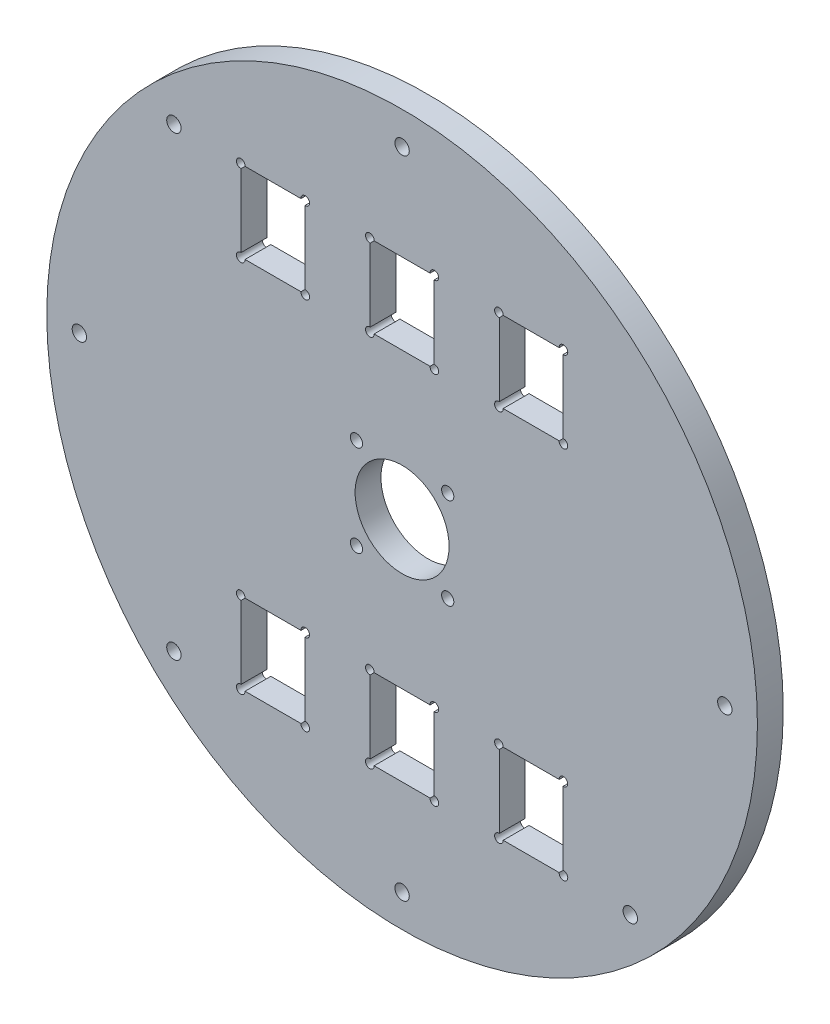
from build123d import *

# Parameters (mm, degrees)
SKETCH1_R              = 82.5
SKETCH1_R_2            = 11
SKETCH1_R_3            = 1.5
SKETCH1_R_4            = 1.75
BOSS_EXTRUDE1_DEPTH    = 6
SKETCH5_W              = 15
SKETCH5_H              = 18.9
CUT_EXTRUDE4_DEPTH     = 117.826794872
SKETCH6_R              = 1
CUT_EXTRUDE5_DEPTH     = 117.826794872
MOVE_FACE1_OUTLINE_R   = 82.58
MOVE_FACE1_OUTLINE_R_2 = 82.5
MOVE_FACE1_OUTLINE_R_3 = 11
MOVE_FACE1_OUTLINE_R_4 = 10.92
MOVE_FACE1_OUTLINE_R_5 = 1.5
MOVE_FACE1_OUTLINE_R_6 = 1.42
MOVE_FACE1_OUTLINE_R_7 = 1.75
MOVE_FACE1_OUTLINE_R_8 = 1.67
MOVE_FACE1_DEPTH       = 6


# Read off the part's stored shape, not the designer's step: Move Face1
with BuildPart() as part:
    # Sketch1 → Boss-Extrude1 (new body)
    with BuildSketch(Plane.XY):
        Circle(SKETCH1_R)
        Circle(SKETCH1_R_2, mode=Mode.SUBTRACT)
        with Locations((10.606601718, -10.606601718)):
            Circle(SKETCH1_R_3, mode=Mode.SUBTRACT)
        with Locations((0, -75)):
            Circle(SKETCH1_R_4, mode=Mode.SUBTRACT)
        with Locations((-10.606601718, -10.606601718)):
            Circle(SKETCH1_R_3, mode=Mode.SUBTRACT)
        with Locations((-10.606601718, 10.606601718)):
            Circle(SKETCH1_R_3, mode=Mode.SUBTRACT)
        with Locations((10.606601718, 10.606601718)):
            Circle(SKETCH1_R_3, mode=Mode.SUBTRACT)
        with Locations((-53.033008589, -53.033008589)):
            Circle(SKETCH1_R_4, mode=Mode.SUBTRACT)
        with Locations((-75, 0)):
            Circle(SKETCH1_R_4, mode=Mode.SUBTRACT)
        with Locations((-53.033008589, 53.033008589)):
            Circle(SKETCH1_R_4, mode=Mode.SUBTRACT)
        with Locations((0, 75)):
            Circle(SKETCH1_R_4, mode=Mode.SUBTRACT)
        with Locations((75, 0)):
            Circle(SKETCH1_R_4, mode=Mode.SUBTRACT)
        with Locations((53.033008589, -53.033008589)):
            Circle(SKETCH1_R_4, mode=Mode.SUBTRACT)
    extrude(amount=BOSS_EXTRUDE1_DEPTH)

    # Sketch5 → Cut-Extrude4 (cut, through all)
    with BuildSketch(Plane.XY.offset(6)):
        with Locations((-30, -43.45)):
            Rectangle(SKETCH5_W, SKETCH5_H)
        with Locations((-30, 43.45)):
            Rectangle(SKETCH5_W, SKETCH5_H)
        with Locations((30, 43.45)):
            Rectangle(SKETCH5_W, SKETCH5_H)
        with Locations((0, -43.45)):
            Rectangle(SKETCH5_W, SKETCH5_H)
        with Locations((30, -43.45)):
            Rectangle(SKETCH5_W, SKETCH5_H)
        with Locations((0, 43.45)):
            Rectangle(SKETCH5_W, SKETCH5_H)
    extrude(amount=-CUT_EXTRUDE4_DEPTH, mode=Mode.SUBTRACT)

    # Sketch6 → Cut-Extrude5 (cut, through all)
    with BuildSketch(Plane.XY.offset(6)):
        with Locations((-37.5, 52.9)):
            Circle(SKETCH6_R)
        with Locations((-22.5, 52.9)):
            Circle(SKETCH6_R)
        with Locations((-37.5, 34)):
            Circle(SKETCH6_R)
        with Locations((-22.5, 34)):
            Circle(SKETCH6_R)
        with Locations((-7.5, 52.9)):
            Circle(SKETCH6_R)
        with Locations((7.5, 52.9)):
            Circle(SKETCH6_R)
        with Locations((-7.5, 34)):
            Circle(SKETCH6_R)
        with Locations((7.5, 34)):
            Circle(SKETCH6_R)
        with Locations((22.5, 52.9)):
            Circle(SKETCH6_R)
        with Locations((37.5, 52.9)):
            Circle(SKETCH6_R)
        with Locations((22.5, 34)):
            Circle(SKETCH6_R)
        with Locations((37.5, 34)):
            Circle(SKETCH6_R)
        with Locations((-37.5, -34)):
            Circle(SKETCH6_R)
        with Locations((-22.5, -34)):
            Circle(SKETCH6_R)
        with Locations((-37.5, -52.9)):
            Circle(SKETCH6_R)
        with Locations((-22.5, -52.9)):
            Circle(SKETCH6_R)
        with Locations((-7.5, -34)):
            Circle(SKETCH6_R)
        with Locations((7.5, -34)):
            Circle(SKETCH6_R)
        with Locations((-7.5, -52.9)):
            Circle(SKETCH6_R)
        with Locations((7.5, -52.9)):
            Circle(SKETCH6_R)
        with Locations((22.5, -34)):
            Circle(SKETCH6_R)
        with Locations((37.5, -34)):
            Circle(SKETCH6_R)
        with Locations((22.5, -52.9)):
            Circle(SKETCH6_R)
        with Locations((37.5, -52.9)):
            Circle(SKETCH6_R)
    extrude(amount=-CUT_EXTRUDE5_DEPTH, mode=Mode.SUBTRACT)

    # Move Face1 outline → Move Face1 (add)
    # profile 1 of 37: a face of its own
    with BuildSketch(Plane.XY):
        Circle(MOVE_FACE1_OUTLINE_R)
        Circle(MOVE_FACE1_OUTLINE_R_2, mode=Mode.SUBTRACT)
    # profile 2 of 37: a face of its own
    with BuildSketch(Plane.XY):
        with BuildLine():
            Line((-37.42, -51.903205136), (-37.42, -34.996794864))
            ThreePointArc((-37.42, -34.996794864), (-37.45996791, -34.999198395), (-37.5, -35))
            Line((-37.5, -35), (-37.5, -51.9))
            ThreePointArc((-37.5, -51.9), (-37.45996791, -51.900801605), (-37.42, -51.903205136))
        make_face()
    # profile 3 of 37: a face of its own
    with BuildSketch(Plane.XY):
        with BuildLine():
            Line((-23.5, -34), (-36.5, -34))
            ThreePointArc((-36.5, -34), (-36.500801605, -34.04003209), (-36.503205136, -34.08))
            Line((-36.503205136, -34.08), (-23.496794864, -34.08))
            ThreePointArc((-23.496794864, -34.08), (-23.499198395, -34.04003209), (-23.5, -34))
        make_face()
    # profile 4 of 37: a face of its own
    with BuildSketch(Plane.XY):
        with BuildLine():
            ThreePointArc((-36.503205136, -52.82), (-36.500801605, -52.85996791), (-36.5, -52.9))
            Line((-36.5, -52.9), (-23.5, -52.9))
            ThreePointArc((-23.5, -52.9), (-23.499198395, -52.85996791), (-23.496794864, -52.82))
            Line((-23.496794864, -52.82), (-36.503205136, -52.82))
        make_face()
    # profile 5 of 37: a face of its own
    with BuildSketch(Plane.XY):
        with BuildLine():
            Line((-22.5, -51.9), (-22.5, -35))
            ThreePointArc((-22.5, -35), (-22.54003209, -34.999198395), (-22.58, -34.996794864))
            Line((-22.58, -34.996794864), (-22.58, -51.903205136))
            ThreePointArc((-22.58, -51.903205136), (-22.54003209, -51.900801605), (-22.5, -51.9))
        make_face()
    # profile 6 of 37: a face of its own
    with BuildSketch(Plane.XY):
        with BuildLine():
            Line((-37.42, 34.996794864), (-37.42, 51.903205136))
            ThreePointArc((-37.42, 51.903205136), (-37.45996791, 51.900801605), (-37.5, 51.9))
            Line((-37.5, 51.9), (-37.5, 35))
            ThreePointArc((-37.5, 35), (-37.45996791, 34.999198395), (-37.42, 34.996794864))
        make_face()
    # profile 7 of 37: a face of its own
    with BuildSketch(Plane.XY):
        with BuildLine():
            Line((-23.5, 52.9), (-36.5, 52.9))
            ThreePointArc((-36.5, 52.9), (-36.500801605, 52.85996791), (-36.503205136, 52.82))
            Line((-36.503205136, 52.82), (-23.496794864, 52.82))
            ThreePointArc((-23.496794864, 52.82), (-23.499198395, 52.85996791), (-23.5, 52.9))
        make_face()
    # profile 8 of 37: a face of its own
    with BuildSketch(Plane.XY):
        with BuildLine():
            ThreePointArc((-36.503205136, 34.08), (-36.500801605, 34.04003209), (-36.5, 34))
            Line((-36.5, 34), (-23.5, 34))
            ThreePointArc((-23.5, 34), (-23.499198395, 34.04003209), (-23.496794864, 34.08))
            Line((-23.496794864, 34.08), (-36.503205136, 34.08))
        make_face()
    # profile 9 of 37: a face of its own
    with BuildSketch(Plane.XY):
        with BuildLine():
            Line((-22.5, 35), (-22.5, 51.9))
            ThreePointArc((-22.5, 51.9), (-22.54003209, 51.900801605), (-22.58, 51.903205136))
            Line((-22.58, 51.903205136), (-22.58, 34.996794864))
            ThreePointArc((-22.58, 34.996794864), (-22.54003209, 34.999198395), (-22.5, 35))
        make_face()
    # profile 10 of 37: a face of its own
    with BuildSketch(Plane.XY):
        with BuildLine():
            Line((-6.503205136, -34.08), (6.503205136, -34.08))
            ThreePointArc((6.503205136, -34.08), (6.500801605, -34.04003209), (6.5, -34))
            Line((6.5, -34), (-6.5, -34))
            ThreePointArc((-6.5, -34), (-6.500801605, -34.04003209), (-6.503205136, -34.08))
        make_face()
    # profile 11 of 37: a face of its own
    with BuildSketch(Plane.XY):
        with BuildLine():
            Line((7.5, -51.9), (7.5, -35))
            ThreePointArc((7.5, -35), (7.45996791, -34.999198395), (7.42, -34.996794864))
            Line((7.42, -34.996794864), (7.42, -51.903205136))
            ThreePointArc((7.42, -51.903205136), (7.45996791, -51.900801605), (7.5, -51.9))
        make_face()
    # profile 12 of 37: a face of its own
    with BuildSketch(Plane.XY):
        with BuildLine():
            ThreePointArc((-7.42, -34.996794864), (-7.45996791, -34.999198395), (-7.5, -35))
            Line((-7.5, -35), (-7.5, -51.9))
            ThreePointArc((-7.5, -51.9), (-7.45996791, -51.900801605), (-7.42, -51.903205136))
            Line((-7.42, -51.903205136), (-7.42, -34.996794864))
        make_face()
    # profile 13 of 37: a face of its own
    with BuildSketch(Plane.XY):
        with BuildLine():
            Line((-6.5, -52.9), (6.5, -52.9))
            ThreePointArc((6.5, -52.9), (6.500801605, -52.85996791), (6.503205136, -52.82))
            Line((6.503205136, -52.82), (-6.503205136, -52.82))
            ThreePointArc((-6.503205136, -52.82), (-6.500801605, -52.85996791), (-6.5, -52.9))
        make_face()
    # profile 14 of 37: a face of its own
    with BuildSketch(Plane.XY):
        with BuildLine():
            Line((23.496794864, -34.08), (36.503205136, -34.08))
            ThreePointArc((36.503205136, -34.08), (36.500801605, -34.04003209), (36.5, -34))
            Line((36.5, -34), (23.5, -34))
            ThreePointArc((23.5, -34), (23.499198395, -34.04003209), (23.496794864, -34.08))
        make_face()
    # profile 15 of 37: a face of its own
    with BuildSketch(Plane.XY):
        with BuildLine():
            Line((37.5, -51.9), (37.5, -35))
            ThreePointArc((37.5, -35), (37.45996791, -34.999198395), (37.42, -34.996794864))
            Line((37.42, -34.996794864), (37.42, -51.903205136))
            ThreePointArc((37.42, -51.903205136), (37.45996791, -51.900801605), (37.5, -51.9))
        make_face()
    # profile 16 of 37: a face of its own
    with BuildSketch(Plane.XY):
        with BuildLine():
            ThreePointArc((22.58, -34.996794864), (22.54003209, -34.999198395), (22.5, -35))
            Line((22.5, -35), (22.5, -51.9))
            ThreePointArc((22.5, -51.9), (22.54003209, -51.900801605), (22.58, -51.903205136))
            Line((22.58, -51.903205136), (22.58, -34.996794864))
        make_face()
    # profile 17 of 37: a face of its own
    with BuildSketch(Plane.XY):
        with BuildLine():
            Line((23.5, -52.9), (36.5, -52.9))
            ThreePointArc((36.5, -52.9), (36.500801605, -52.85996791), (36.503205136, -52.82))
            Line((36.503205136, -52.82), (23.496794864, -52.82))
            ThreePointArc((23.496794864, -52.82), (23.499198395, -52.85996791), (23.5, -52.9))
        make_face()
    # profile 18 of 37: a face of its own
    with BuildSketch(Plane.XY):
        with BuildLine():
            Line((23.496794864, 52.82), (36.503205136, 52.82))
            ThreePointArc((36.503205136, 52.82), (36.500801605, 52.85996791), (36.5, 52.9))
            Line((36.5, 52.9), (23.5, 52.9))
            ThreePointArc((23.5, 52.9), (23.499198395, 52.85996791), (23.496794864, 52.82))
        make_face()
    # profile 19 of 37: a face of its own
    with BuildSketch(Plane.XY):
        with BuildLine():
            Line((37.5, 35), (37.5, 51.9))
            ThreePointArc((37.5, 51.9), (37.45996791, 51.900801605), (37.42, 51.903205136))
            Line((37.42, 51.903205136), (37.42, 34.996794864))
            ThreePointArc((37.42, 34.996794864), (37.45996791, 34.999198395), (37.5, 35))
        make_face()
    # profile 20 of 37: a face of its own
    with BuildSketch(Plane.XY):
        with BuildLine():
            ThreePointArc((22.58, 51.903205136), (22.54003209, 51.900801605), (22.5, 51.9))
            Line((22.5, 51.9), (22.5, 35))
            ThreePointArc((22.5, 35), (22.54003209, 34.999198395), (22.58, 34.996794864))
            Line((22.58, 34.996794864), (22.58, 51.903205136))
        make_face()
    # profile 21 of 37: a face of its own
    with BuildSketch(Plane.XY):
        with BuildLine():
            Line((23.5, 34), (36.5, 34))
            ThreePointArc((36.5, 34), (36.500801605, 34.04003209), (36.503205136, 34.08))
            Line((36.503205136, 34.08), (23.496794864, 34.08))
            ThreePointArc((23.496794864, 34.08), (23.499198395, 34.04003209), (23.5, 34))
        make_face()
    # profile 22 of 37: a face of its own
    with BuildSketch(Plane.XY):
        with BuildLine():
            Line((-6.503205136, 52.82), (6.503205136, 52.82))
            ThreePointArc((6.503205136, 52.82), (6.500801605, 52.85996791), (6.5, 52.9))
            Line((6.5, 52.9), (-6.5, 52.9))
            ThreePointArc((-6.5, 52.9), (-6.500801605, 52.85996791), (-6.503205136, 52.82))
        make_face()
    # profile 23 of 37: a face of its own
    with BuildSketch(Plane.XY):
        with BuildLine():
            Line((7.5, 35), (7.5, 51.9))
            ThreePointArc((7.5, 51.9), (7.45996791, 51.900801605), (7.42, 51.903205136))
            Line((7.42, 51.903205136), (7.42, 34.996794864))
            ThreePointArc((7.42, 34.996794864), (7.45996791, 34.999198395), (7.5, 35))
        make_face()
    # profile 24 of 37: a face of its own
    with BuildSketch(Plane.XY):
        with BuildLine():
            ThreePointArc((-7.42, 51.903205136), (-7.45996791, 51.900801605), (-7.5, 51.9))
            Line((-7.5, 51.9), (-7.5, 35))
            ThreePointArc((-7.5, 35), (-7.45996791, 34.999198395), (-7.42, 34.996794864))
            Line((-7.42, 34.996794864), (-7.42, 51.903205136))
        make_face()
    # profile 25 of 37: a face of its own
    with BuildSketch(Plane.XY):
        with BuildLine():
            Line((-6.5, 34), (6.5, 34))
            ThreePointArc((6.5, 34), (6.500801605, 34.04003209), (6.503205136, 34.08))
            Line((6.503205136, 34.08), (-6.503205136, 34.08))
            ThreePointArc((-6.503205136, 34.08), (-6.500801605, 34.04003209), (-6.5, 34))
        make_face()
    # profile 26 of 37: a face of its own
    with BuildSketch(Plane.XY):
        Circle(MOVE_FACE1_OUTLINE_R_3)
        Circle(MOVE_FACE1_OUTLINE_R_4, mode=Mode.SUBTRACT)
    # profile 27 of 37: a face of its own
    with BuildSketch(Plane.XY):
        with Locations((10.606601718, -10.606601718)):
            Circle(MOVE_FACE1_OUTLINE_R_5)
        with Locations((10.606601718, -10.606601718)):
            Circle(MOVE_FACE1_OUTLINE_R_6, mode=Mode.SUBTRACT)
    # profile 28 of 37: a face of its own
    with BuildSketch(Plane.XY):
        with Locations((0, -75)):
            Circle(MOVE_FACE1_OUTLINE_R_7)
        with Locations((0, -75)):
            Circle(MOVE_FACE1_OUTLINE_R_8, mode=Mode.SUBTRACT)
    # profile 29 of 37: a face of its own
    with BuildSketch(Plane.XY):
        with Locations((-10.606601718, -10.606601718)):
            Circle(MOVE_FACE1_OUTLINE_R_5)
        with Locations((-10.606601718, -10.606601718)):
            Circle(MOVE_FACE1_OUTLINE_R_6, mode=Mode.SUBTRACT)
    # profile 30 of 37: a face of its own
    with BuildSketch(Plane.XY):
        with Locations((-10.606601718, 10.606601718)):
            Circle(MOVE_FACE1_OUTLINE_R_5)
        with Locations((-10.606601718, 10.606601718)):
            Circle(MOVE_FACE1_OUTLINE_R_6, mode=Mode.SUBTRACT)
    # profile 31 of 37: a face of its own
    with BuildSketch(Plane.XY):
        with Locations((10.606601718, 10.606601718)):
            Circle(MOVE_FACE1_OUTLINE_R_5)
        with Locations((10.606601718, 10.606601718)):
            Circle(MOVE_FACE1_OUTLINE_R_6, mode=Mode.SUBTRACT)
    # profile 32 of 37: a face of its own
    with BuildSketch(Plane.XY):
        with Locations((-53.033008589, -53.033008589)):
            Circle(MOVE_FACE1_OUTLINE_R_7)
        with Locations((-53.033008589, -53.033008589)):
            Circle(MOVE_FACE1_OUTLINE_R_8, mode=Mode.SUBTRACT)
    # profile 33 of 37: a face of its own
    with BuildSketch(Plane.XY):
        with Locations((-75, 0)):
            Circle(MOVE_FACE1_OUTLINE_R_7)
        with Locations((-75, 0)):
            Circle(MOVE_FACE1_OUTLINE_R_8, mode=Mode.SUBTRACT)
    # profile 34 of 37: a face of its own
    with BuildSketch(Plane.XY):
        with Locations((-53.033008589, 53.033008589)):
            Circle(MOVE_FACE1_OUTLINE_R_7)
        with Locations((-53.033008589, 53.033008589)):
            Circle(MOVE_FACE1_OUTLINE_R_8, mode=Mode.SUBTRACT)
    # profile 35 of 37: a face of its own
    with BuildSketch(Plane.XY):
        with Locations((0, 75)):
            Circle(MOVE_FACE1_OUTLINE_R_7)
        with Locations((0, 75)):
            Circle(MOVE_FACE1_OUTLINE_R_8, mode=Mode.SUBTRACT)
    # profile 36 of 37: a face of its own
    with BuildSketch(Plane.XY):
        with Locations((75, 0)):
            Circle(MOVE_FACE1_OUTLINE_R_7)
        with Locations((75, 0)):
            Circle(MOVE_FACE1_OUTLINE_R_8, mode=Mode.SUBTRACT)
    # profile 37 of 37: a face of its own
    with BuildSketch(Plane.XY):
        with Locations((53.033008589, -53.033008589)):
            Circle(MOVE_FACE1_OUTLINE_R_7)
        with Locations((53.033008589, -53.033008589)):
            Circle(MOVE_FACE1_OUTLINE_R_8, mode=Mode.SUBTRACT)
    extrude(amount=MOVE_FACE1_DEPTH)


solid = part.part
